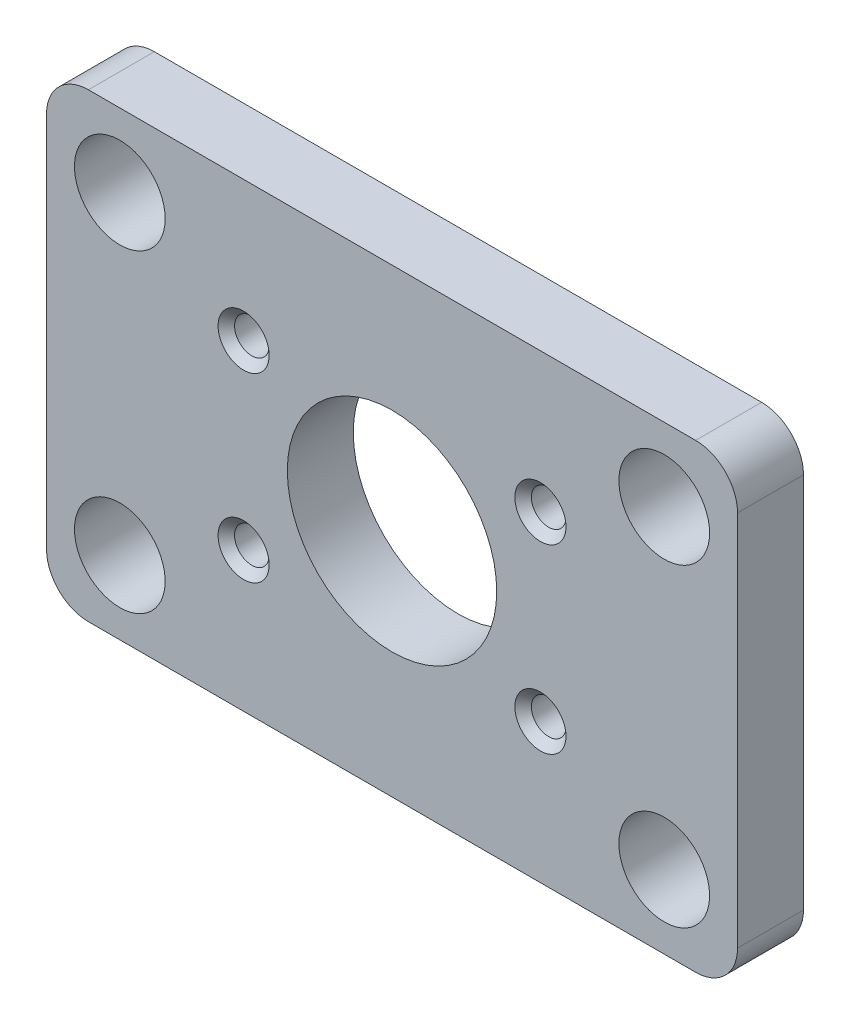
from build123d import *

# Parameters (mm, degrees)
SKETCH1_W           = 41.91
SKETCH1_H           = 27.94
SKETCH1_R           = 2.75
SKETCH1_R_2         = 1.05
SKETCH1_R_3         = 6.35
BOSS_EXTRUDE1_DEPTH = 4
FILLET1_R           = 2.54
CHAMFER1_SIZE       = 0.5


with BuildPart() as part:
    # Sketch1 → Boss-Extrude1 (new body)
    with BuildSketch(Plane.XY):
        Rectangle(SKETCH1_W, SKETCH1_H)
        with Locations((-16.51, 9.525)):
            Circle(SKETCH1_R, mode=Mode.SUBTRACT)
        with Locations((16.51, 9.525)):
            Circle(SKETCH1_R, mode=Mode.SUBTRACT)
        with Locations((16.51, -9.525)):
            Circle(SKETCH1_R, mode=Mode.SUBTRACT)
        with Locations((-16.51, -9.525)):
            Circle(SKETCH1_R, mode=Mode.SUBTRACT)
        with Locations((-9.00049, 5.50037)):
            Circle(SKETCH1_R_2, mode=Mode.SUBTRACT)
        with Locations((9.00049, -5.50037)):
            Circle(SKETCH1_R_2, mode=Mode.SUBTRACT)
        Circle(SKETCH1_R_3, mode=Mode.SUBTRACT)
        with Locations((-9.00049, -5.50037)):
            Circle(SKETCH1_R_2, mode=Mode.SUBTRACT)
        with Locations((9.00049, 5.50037)):
            Circle(SKETCH1_R_2, mode=Mode.SUBTRACT)
    extrude(amount=BOSS_EXTRUDE1_DEPTH)

    # Fillet1
    fillet1_edges = [part.edges().sort_by_distance(p)[0] for p in [
        (20.955, 13.97, 2),
        (20.955, -13.97, 2),
        (-20.955, -13.97, 2),
        (-20.955, 13.97, 2),
    ]]
    fillet(fillet1_edges, radius=FILLET1_R)

    # Chamfer1
    chamfer1_edges = [part.edges().sort_by_distance(p)[0] for p in [
        (7.95049, -5.50037, 4),
        (7.95049, 5.50037, 4),
        (-10.05049, -5.50037, 4),
        (-10.05049, 5.50037, 4),
    ]]
    chamfer(chamfer1_edges, length=CHAMFER1_SIZE)


solid = part.part
